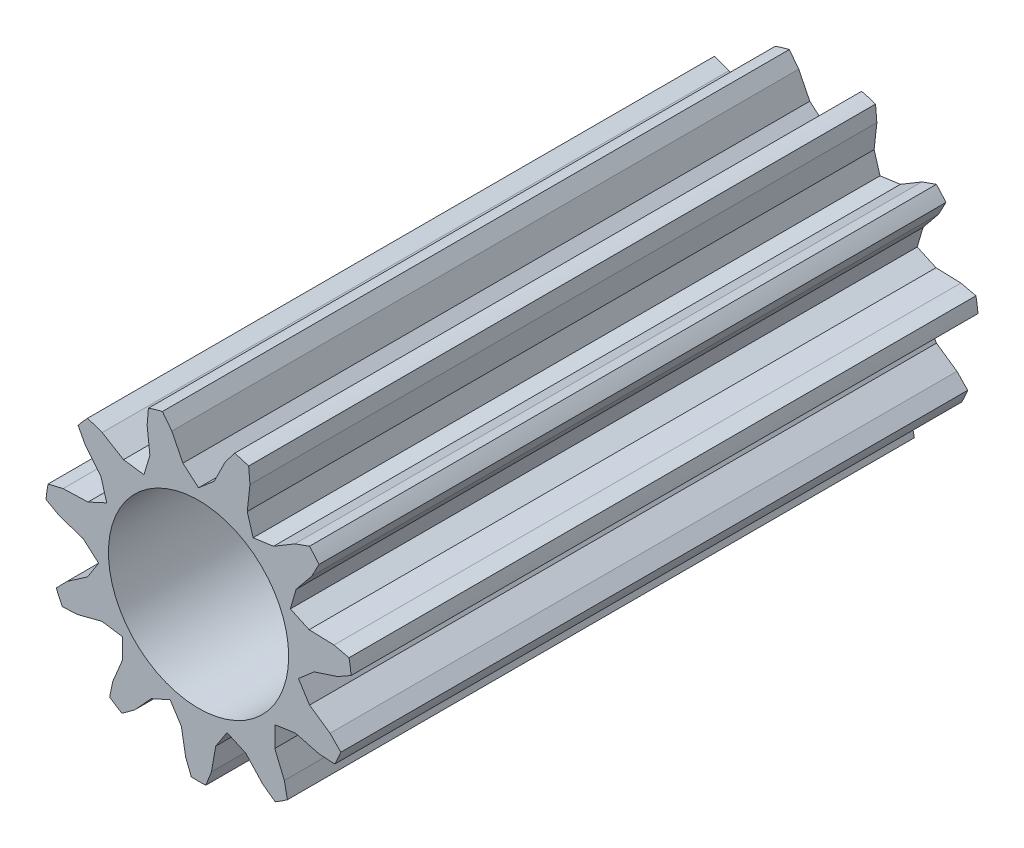
from build123d import *

# Parameters (mm, degrees)
SKETCH1_R               = 9.7778
BOSS_EXTRUDE1_DEPTH     = 40
CUT_EXTRUDE1_DEPTH      = 43.32269776
CUT_EXTRUDE2_DEPTH      = 43.32269776
CUT_EXTRUDE2_DEPTH_BACK = 43.32269776
SKETCH4_R               = 5.75
CIRPATTERN1_COUNT       = 11


with BuildPart() as part:
    # Sketch1 → Boss-Extrude1 (new body)
    with BuildSketch(Plane.XY):
        Circle(SKETCH1_R)
    extrude(amount=BOSS_EXTRUDE1_DEPTH)

    # Sketch2 → Cut-Extrude1 (cut, through all)
    with BuildSketch(Plane.XY):
        Polygon((0, 6.440231992), (-0.998470792, 7.29965938), (-1.704297747, 8.720724317), (-2.306603416, 9.501839481), (-1.704297747, 10.285038999), (0, 10.999278518), (1.704297747, 10.285038999), (2.306603416, 9.501839481), (1.704297747, 8.720724317), (0.998470792, 7.29965938), align=None)
    cut_extrude1 = extrude(amount=CUT_EXTRUDE1_DEPTH, mode=Mode.SUBTRACT)

    # Sketch4 → Cut-Extrude2 (cut, two sides: drawn at the far end of the back side and taken through both)
    with BuildSketch(Plane.XY.offset(40).offset(-CUT_EXTRUDE2_DEPTH_BACK)):
        Circle(SKETCH4_R)
    extrude(amount=CUT_EXTRUDE2_DEPTH + CUT_EXTRUDE2_DEPTH_BACK, mode=Mode.SUBTRACT)

    # CirPattern1: Cut-Extrude1 ×11 about axis
    cirpattern1_axis = Axis((0, 0, 40), (0, 0, -1))
    for i in range(1, CIRPATTERN1_COUNT):
        add(cut_extrude1.rotate(cirpattern1_axis, i * 360 / CIRPATTERN1_COUNT), mode=Mode.SUBTRACT)


solid = part.part
